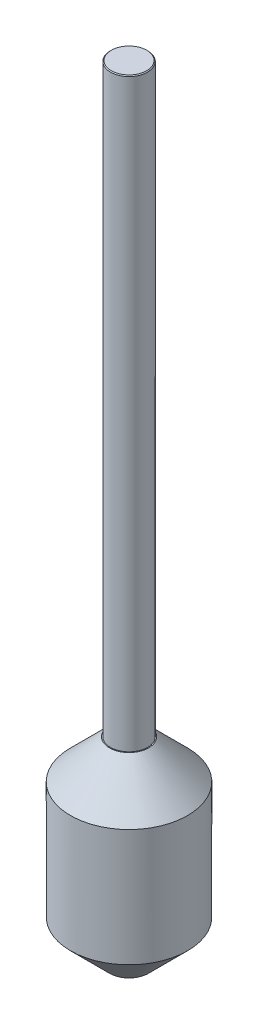
from build123d import *


# Read off the part's stored shape, not the designer's step: M10x0.75 Machine Threads Stud1
with BuildPart() as part:
    # Sketch1 → Revolve2 (revolve)
    with BuildSketch(Plane.XY, mode=Mode.PRIVATE) as revolve2_sk:
        Polygon((0, 0), (0, 150), (5, 150), (5, -50), (0, -50), (-10, -40), (-10, -10), align=None)
    revolve(revolve2_sk.sketch.rotate(Axis((5, 0, 0), (0, 1, 0)), 270), axis=Axis((5, 0, 0), (0, 1, 0)))

    # M10x0.75 Machine Threads Stud1 outline → M10x0.75 Machine Threads Stud1 (revolve, cut)
    with BuildSketch(Plane(origin=(5, 0, 0), x_dir=(1, 0, 0), z_dir=(0, 0, 1))):
        Polygon((5, 150), (4.54, 150), (4.7565, 149.7835), (4.7565, 0), (5, 0), align=None)
    revolve(axis=Axis((5, 0, 0), (0, 1, 0)), mode=Mode.SUBTRACT)


solid = part.part
